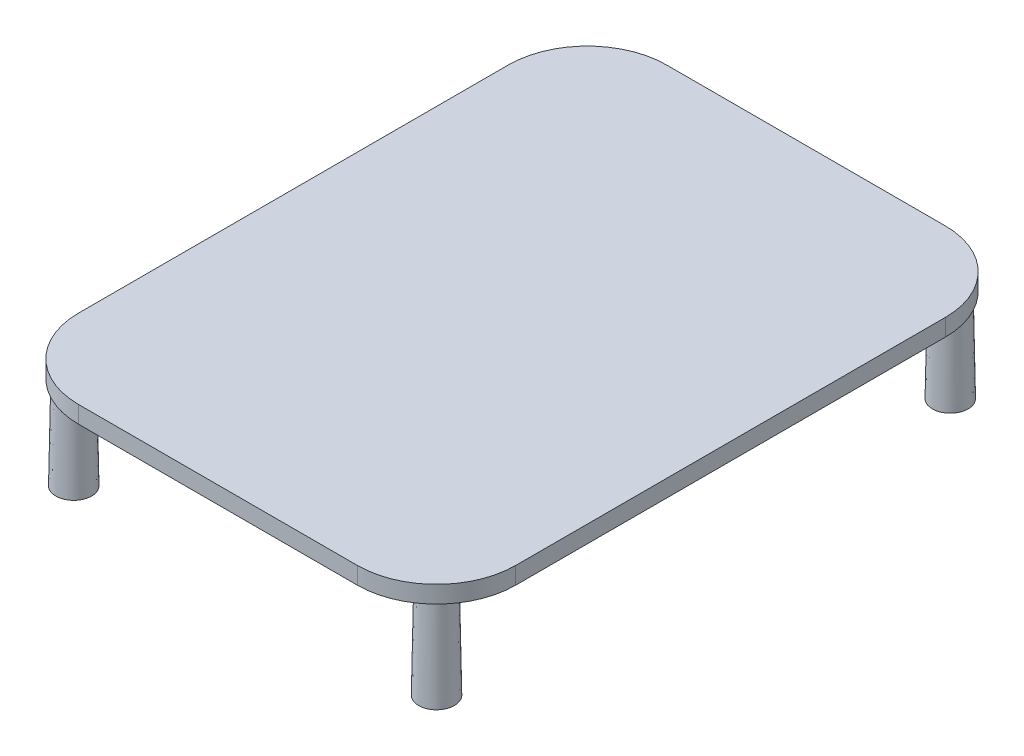
from build123d import *

# Parameters (mm, degrees)
BOSS_EXTRUDE1_DEPTH           = 8.5
FILLET1_R                     = 7
CUT_EXTRUDE1_DEPTH            = 38.350780577
CUT_EXTRUDE1_DEPTH_BACK       = 38.350780577
CUT_EXTRUDE2_DEPTH            = 0.5
FILLET2_R                     = 1
SKETCH7_R                     = 1.4
BOSS_EXTRUDE2_DEPTH           = 8
BOSS_EXTRUDE2_DRAFT           = -1
BOSS_EXTRUDE2_PROFILE_2_DEPTH = 8
BOSS_EXTRUDE2_PROFILE_2_DRAFT = -1
BOSS_EXTRUDE2_PROFILE_3_DEPTH = 8
BOSS_EXTRUDE2_PROFILE_3_DRAFT = -1
BOSS_EXTRUDE2_PROFILE_4_DEPTH = 8
BOSS_EXTRUDE2_PROFILE_4_DRAFT = -1
BOSS_EXTRUDE4_START           = 7.026316
BOSS_EXTRUDE4_DEPTH           = 1.473684
CUT_EXTRUDE3_START            = 7.026316
SKETCH12_W                    = 34
SKETCH12_H                    = 40
CUT_EXTRUDE3_DEPTH            = 0.5


with BuildPart() as part:
    # Sketch1 → Boss-Extrude1 (new, symmetric)
    with BuildSketch(Plane(origin=(0, 0, 0), x_dir=(1, 0, 0), z_dir=(0, 1, 0))):
        with BuildLine():
            Line((12, 22.5), (-12, 22.5))
            ThreePointArc((-12, 22.5), (-14.828427125, 21.328427125), (-16, 18.5))
            Line((-16, 18.5), (-16, -18.5))
            ThreePointArc((-16, -18.5), (-14.828427125, -21.328427125), (-12, -22.5))
            Line((-12, -22.5), (12, -22.5))
            ThreePointArc((12, -22.5), (14.828427125, -21.328427125), (16, -18.5))
            Line((16, -18.5), (16, 18.5))
            ThreePointArc((16, 18.5), (14.828427125, 21.328427125), (12, 22.5))
        make_face()
    extrude(amount=BOSS_EXTRUDE1_DEPTH, both=True)

    # Sweep1: sweep along a path in Sketch3
    with BuildLine(Plane(origin=(0, 0, 0), x_dir=(1, 0, 0), z_dir=(0, 1, 0))) as sweep1_path:
        Line((12, 22.5), (-12, 22.5))
        ThreePointArc((-12, 22.5), (-14.828427125, 21.328427125), (-16, 18.5))
        Line((-16, 18.5), (-16, -18.5))
        ThreePointArc((-16, -18.5), (-14.828427125, -21.328427125), (-12, -22.5))
        Line((-12, -22.5), (12, -22.5))
        ThreePointArc((12, -22.5), (14.828427125, -21.328427125), (16, -18.5))
        Line((16, -18.5), (16, 18.5))
        ThreePointArc((16, 18.5), (14.828427125, 21.328427125), (12, 22.5))
    # Sketch2 → Sweep1 (sweep)
    with BuildSketch(Plane(origin=(0, 0, 0), x_dir=(0, 0, -1), z_dir=(1, 0, 0))):
        with BuildLine():
            Line((22.5, 8.5), (22.5, -8.5))
            ThreePointArc((22.5, -8.5), (28.761818808, 0), (22.5, 8.5))
        make_face()
    sweep(path=sweep1_path.line)

    # Fillet1
    fillet1_edges = [part.edges().sort_by_distance(p)[0] for p in [
        (0, -8.5, 22.5),
        (-14.828427125, -8.5, 21.328427125),
        (-16, -8.5, 0),
        (-14.828427125, -8.5, -21.328427125),
        (-14.828427125, 8.5, 21.328427125),
        (0, 8.5, 22.5),
        (14.828427125, 8.5, 21.328427125),
        (16, 8.5, 0),
        (0, -8.5, -22.5),
        (0, 8.5, -22.5),
        (14.828427125, 8.5, -21.328427125),
        (0, 8.5, -22.5),
        (-14.828427125, 8.5, -21.328427125),
        (0, -8.5, -22.5),
        (-16, 8.5, 0),
        (14.828427125, -8.5, -21.328427125),
        (16, -8.5, 0),
        (14.828427125, -8.5, 21.328427125),
    ]]
    fillet(fillet1_edges, radius=FILLET1_R)

    # Sketch4 → Cut-Extrude1 (cut, two sides: drawn at the far end of the back side and taken through both)
    with BuildSketch(Plane.XY.offset(-CUT_EXTRUDE1_DEPTH_BACK)):
        Polygon((-18.824500057, 7.026315789), (23.208390428, 7.026315789), (23.208390428, -10.963079456), (-23.528948307, -10.963079456), (-23.528948307, 7.026315789), align=None)
    extrude(amount=CUT_EXTRUDE1_DEPTH + CUT_EXTRUDE1_DEPTH_BACK, mode=Mode.SUBTRACT)

    # Sketch6 → Cut-Extrude2 (cut)
    with BuildSketch(Plane.XZ.offset(-7.026315789)):
        with BuildLine():
            Line((13, 20), (-13, 20))
            ThreePointArc((-13, 20), (-15.828427125, 18.828427125), (-17, 16))
            Line((-17, 16), (-17, -16))
            ThreePointArc((-17, -16), (-15.828427125, -18.828427125), (-13, -20))
            Line((-13, -20), (13, -20))
            ThreePointArc((13, -20), (15.828427125, -18.828427125), (17, -16))
            Line((17, -16), (17, 16))
            ThreePointArc((17, 16), (15.828427125, 18.828427125), (13, 20))
        make_face()
    extrude(amount=-CUT_EXTRUDE2_DEPTH, mode=Mode.SUBTRACT)

    # Fillet2
    # the kernel refuses this fillet: 1 mm, written as the material it adds along each edge
    with BuildSketch(Plane(origin=(13, 7.526315789, 20), x_dir=(0, -1, 0), z_dir=(-1, 0, 0)), Plane(origin=(-13, 7.526315789, -20), x_dir=(0, -1, 0), z_dir=(1, 0, 0))) as fillet2_piece_1:
        with BuildLine():
            CenterArc((1, -0.866025404), FILLET2_R, 120, 60)
            Line((0, -0.866025404), (-0.02, -0.866025404))
            Line((-0.02, -0.866025404), (-0.02, 0))
            Line((-0.02, 0), (0, 0.02))
            ThreePointArc((0, 0.02), (0.25, 0.02), (0.49, 0.017320508))
            Line((0.49, 0.017320508), (0.5, 0))
        make_face()
    extrude(amount=26)
    with BuildSketch(Plane(origin=(13, 7.526315789, 16), x_dir=(1, 0, 0), z_dir=(0, 0, -1))) as fillet2_piece_2:
        with BuildLine():
            CenterArc((3.133974596, 1), FILLET2_R, 270, 60)
            Line((3.133974596, 0), (3.133974596, -0.02))
            Line((3.133974596, -0.02), (4, -0.02))
            Line((4, -0.02), (4.02, 0))
            ThreePointArc((4.02, 0), (4.02, 0.25), (4.017320508, 0.49))
            Line((4.017320508, 0.49), (4, 0.5))
        make_face()
    revolve(axis=Axis((13, 7.526315789, 16), (0, -1, 0)), revolution_arc=90)
    with BuildSketch(Plane(origin=(17, 7.526315789, -16), x_dir=(0, -1, 0), z_dir=(0, 0, 1)), Plane(origin=(-17, 7.526315789, 16), x_dir=(0, -1, 0), z_dir=(0, 0, -1))) as fillet2_piece_3:
        with BuildLine():
            CenterArc((1, -0.866025404), FILLET2_R, 120, 60)
            Line((0, -0.866025404), (-0.02, -0.866025404))
            Line((-0.02, -0.866025404), (-0.02, 0))
            Line((-0.02, 0), (0, 0.02))
            ThreePointArc((0, 0.02), (0.25, 0.02), (0.49, 0.017320508))
            Line((0.49, 0.017320508), (0.5, 0))
        make_face()
    extrude(amount=32)
    with BuildSketch(Plane(origin=(13, 7.526315789, -16), x_dir=(0, 0, -1), z_dir=(-1, 0, 0))) as fillet2_piece_4:
        with BuildLine():
            CenterArc((3.133974596, 1), FILLET2_R, 270, 60)
            Line((3.133974596, 0), (3.133974596, -0.02))
            Line((3.133974596, -0.02), (4, -0.02))
            Line((4, -0.02), (4.02, 0))
            ThreePointArc((4.02, 0), (4.02, 0.25), (4.017320508, 0.49))
            Line((4.017320508, 0.49), (4, 0.5))
        make_face()
    revolve(axis=Axis((13, 7.526315789, -16), (0, -1, 0)), revolution_arc=90)
    with BuildSketch(Plane(origin=(-13, 7.526315789, -16), x_dir=(-1, 0, 0), z_dir=(0, 0, 1))) as fillet2_piece_5:
        with BuildLine():
            CenterArc((3.133974596, 1), FILLET2_R, 270, 60)
            Line((3.133974596, 0), (3.133974596, -0.02))
            Line((3.133974596, -0.02), (4, -0.02))
            Line((4, -0.02), (4.02, 0))
            ThreePointArc((4.02, 0), (4.02, 0.25), (4.017320508, 0.49))
            Line((4.017320508, 0.49), (4, 0.5))
        make_face()
    revolve(axis=Axis((-13, 7.526315789, -16), (0, -1, 0)), revolution_arc=90)
    with BuildSketch(Plane(origin=(-13, 7.526315789, 16), x_dir=(0, 0, 1), z_dir=(1, 0, 0))) as fillet2_piece_6:
        with BuildLine():
            CenterArc((3.133974596, 1), FILLET2_R, 270, 60)
            Line((3.133974596, 0), (3.133974596, -0.02))
            Line((3.133974596, -0.02), (4, -0.02))
            Line((4, -0.02), (4.02, 0))
            ThreePointArc((4.02, 0), (4.02, 0.25), (4.017320508, 0.49))
            Line((4.017320508, 0.49), (4, 0.5))
        make_face()
    revolve(axis=Axis((-13, 7.526315789, 16), (0, -1, 0)), revolution_arc=90)


with BuildPart() as boss_extrude2_tool:
    # Sketch7 → Boss-Extrude2 (with draft: the straight prism first)
    with BuildSketch(Plane.XZ.offset(-7.026315789)):
        with Locations((-15.624500057, 22.124500057)):
            Circle(SKETCH7_R)
    extrude(amount=BOSS_EXTRUDE2_DEPTH)
    # Boss-Extrude2: the draft: its side faces are tilted about the plane it starts from
    boss_extrude2_sides = [boss_extrude2_tool.faces().sort_by_distance(p)[0] for p in [
        (-17.024500057, 3.026315789, 22.124500057),
    ]]
    draft(boss_extrude2_sides, Plane.XZ.offset(-7.026315789), BOSS_EXTRUDE2_DRAFT)


with BuildPart() as part_1:
    add(part.part)

    # Boss-Extrude2: add boss_extrude2_tool
    add(boss_extrude2_tool.part)


with BuildPart() as boss_extrude2_profile_2_tool:
    # Sketch7 → Boss-Extrude2 profile 2 (with draft: the straight prism first)
    with BuildSketch(Plane.XZ.offset(-7.026315789)):
        with Locations((15.624500057, 22.124500057)):
            Circle(SKETCH7_R)
    extrude(amount=BOSS_EXTRUDE2_PROFILE_2_DEPTH)
    # Boss-Extrude2 profile 2: the draft: its side faces are tilted about the plane it starts from
    boss_extrude2_profile_2_sides = [boss_extrude2_profile_2_tool.faces().sort_by_distance(p)[0] for p in [
        (14.224500057, 3.026315789, 22.124500057),
    ]]
    draft(boss_extrude2_profile_2_sides, Plane.XZ.offset(-7.026315789), BOSS_EXTRUDE2_PROFILE_2_DRAFT)


with BuildPart() as part_2:
    add(part_1.part)

    # Boss-Extrude2 profile 2: add boss_extrude2_profile_2_tool
    add(boss_extrude2_profile_2_tool.part)


with BuildPart() as boss_extrude2_profile_3_tool:
    # Sketch7 → Boss-Extrude2 profile 3 (with draft: the straight prism first)
    with BuildSketch(Plane.XZ.offset(-7.026315789)):
        with Locations((15.624500057, -22.124500057)):
            Circle(SKETCH7_R)
    extrude(amount=BOSS_EXTRUDE2_PROFILE_3_DEPTH)
    # Boss-Extrude2 profile 3: the draft: its side faces are tilted about the plane it starts from
    boss_extrude2_profile_3_sides = [boss_extrude2_profile_3_tool.faces().sort_by_distance(p)[0] for p in [
        (14.224500057, 3.026315789, -22.124500057),
    ]]
    draft(boss_extrude2_profile_3_sides, Plane.XZ.offset(-7.026315789), BOSS_EXTRUDE2_PROFILE_3_DRAFT)


with BuildPart() as part_3:
    add(part_2.part)

    # Boss-Extrude2 profile 3: add boss_extrude2_profile_3_tool
    add(boss_extrude2_profile_3_tool.part)


with BuildPart() as boss_extrude2_profile_4_tool:
    # Sketch7 → Boss-Extrude2 profile 4 (with draft: the straight prism first)
    with BuildSketch(Plane.XZ.offset(-7.026315789)):
        with Locations((-15.624500057, -22.124500057)):
            Circle(SKETCH7_R)
    extrude(amount=BOSS_EXTRUDE2_PROFILE_4_DEPTH)
    # Boss-Extrude2 profile 4: the draft: its side faces are tilted about the plane it starts from
    boss_extrude2_profile_4_sides = [boss_extrude2_profile_4_tool.faces().sort_by_distance(p)[0] for p in [
        (-17.024500057, 3.026315789, -22.124500057),
    ]]
    draft(boss_extrude2_profile_4_sides, Plane.XZ.offset(-7.026315789), BOSS_EXTRUDE2_PROFILE_4_DRAFT)


with BuildPart() as part_4:
    add(part_3.part)

    # Boss-Extrude2 profile 4: add boss_extrude2_profile_4_tool
    add(boss_extrude2_profile_4_tool.part)

    # Sketch11 → Boss-Extrude4 (add)
    with BuildSketch(Plane(origin=(0, 0, 0), x_dir=(1, 0, 0), z_dir=(0, 1, 0)).offset(BOSS_EXTRUDE4_START)):
        with BuildLine():
            Line((12.005, 25.325), (-12.005, 25.325))
            ThreePointArc((-12.005, 25.325), (-16.827468248, 23.327468248), (-18.825, 18.505))
            Line((-18.825, 18.505), (-18.825, -18.505))
            ThreePointArc((-18.825, -18.505), (-16.827468248, -23.327468248), (-12.005, -25.325))
            Line((-12.005, -25.325), (12.005, -25.325))
            ThreePointArc((12.005, -25.325), (16.827468248, -23.327468248), (18.825, -18.505))
            Line((18.825, -18.505), (18.825, 18.505))
            ThreePointArc((18.825, 18.505), (16.827468248, 23.327468248), (12.005, 25.325))
        make_face()
    extrude(amount=BOSS_EXTRUDE4_DEPTH)

    # Sketch12 → Cut-Extrude3 (cut)
    with BuildSketch(Plane(origin=(0, 0, 0), x_dir=(1, 0, 0), z_dir=(0, 1, 0)).offset(CUT_EXTRUDE3_START)):
        Rectangle(SKETCH12_W, SKETCH12_H)
    extrude(amount=CUT_EXTRUDE3_DEPTH, mode=Mode.SUBTRACT)


solid = part_4.part
